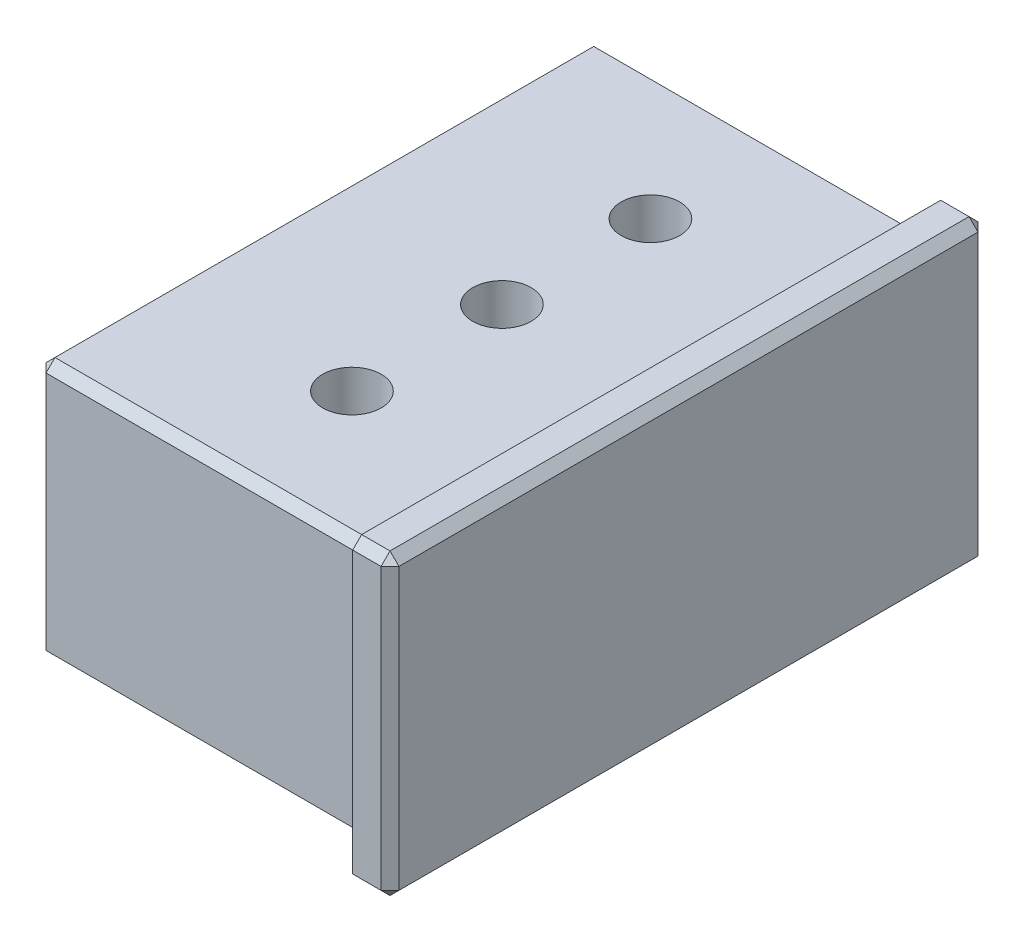
from build123d import *

# Parameters (mm, degrees)
SKETCH1_W           = 47.371
SKETCH1_H           = 21.971
BOSS_EXTRUDE1_DEPTH = 28.575
SKETCH2_W           = 50.8
SKETCH2_H           = 25.4
BOSS_EXTRUDE2_DEPTH = 3.175
CHAMFER1_SIZE       = 0.762
SKETCH3_R           = 2.4892
CUT_EXTRUDE1_DEPTH  = 64.074969049


with BuildPart() as part:
    # Sketch1 → Boss-Extrude1 (new body)
    with BuildSketch(Plane(origin=(0, 0, 0), x_dir=(0, 0, -1), z_dir=(1, 0, 0))):
        with Locations((23.6855, 10.9855)):
            Rectangle(SKETCH1_W, SKETCH1_H)
    extrude(amount=BOSS_EXTRUDE1_DEPTH)

    # Sketch2 → Boss-Extrude2 (add)
    with BuildSketch(Plane(origin=(28.575, 0, 0), x_dir=(0, 0, -1), z_dir=(1, 0, 0))):
        with Locations((23.6855, 10.9855)):
            Rectangle(SKETCH2_W, SKETCH2_H)
    extrude(amount=BOSS_EXTRUDE2_DEPTH)

    # Chamfer1
    chamfer1_edges = [part.edges().sort_by_distance(p)[0] for p in [
        (31.75, 23.6855, -23.6855),
        (30.1625, 23.6855, -49.0855),
        (31.75, 10.9855, -49.0855),
        (30.1625, -1.7145, -49.0855),
        (31.75, -1.7145, -23.6855),
        (30.1625, -1.7145, 1.7145),
        (31.75, 10.9855, 1.7145),
        (30.1625, 23.6855, 1.7145),
        (0, 0, -23.6855),
        (14.2875, 0, -47.371),
        (0, 10.9855, -47.371),
        (14.2875, 21.971, -47.371),
        (0, 21.971, -23.6855),
        (14.2875, 21.971, 0),
        (0, 10.9855, 0),
        (14.2875, 0, 0),
    ]]
    chamfer(chamfer1_edges, length=CHAMFER1_SIZE)

    # Sketch3 → Cut-Extrude1 (cut, through all)
    with BuildSketch(Plane(origin=(0, 21.971, 0), x_dir=(1, 0, 0), z_dir=(0, 1, 0))):
        with Locations((15.875, 23.6855)):
            Circle(SKETCH3_R)
        with Locations((15.875, 36.322)):
            Circle(SKETCH3_R)
        with Locations((15.875, 10.922)):
            Circle(SKETCH3_R)
    extrude(amount=-CUT_EXTRUDE1_DEPTH, mode=Mode.SUBTRACT)


solid = part.part
